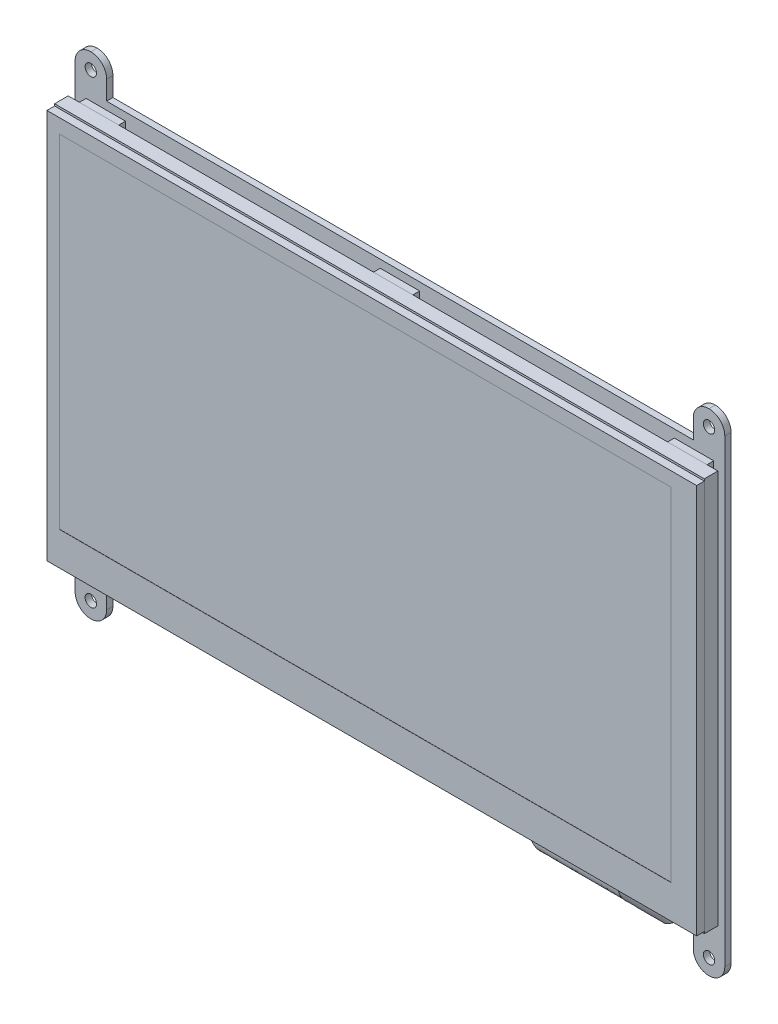
from build123d import *

# Parameters (mm, degrees)
PCBA_DEPTH         = 1.6
FILLET1_R          = 4
SKETCH2_R          = 1.45
SCREWHOLE_DEPTH    = 104.374149211
SKETCH5_W          = 10
SKETCH5_H          = 94.96
TAPE_DEPTH         = 1.75
SKETCH6_W          = 164.9
SKETCH6_H          = 100
BACKLIGHT_DEPTH    = 3.45
SKETCH7_W          = 164.9
SKETCH7_H          = 99
LCDNTOUCH_DEPTH    = 1.95
SWEEP1_START       = 62.28
SWEEP1_DEPTH       = 13.7
SWEEP2_START       = 38.48
SWEEP2_DEPTH       = 22.9
CUT_EXTRUDE3_DEPTH = 31.65
SKETCH16_W         = 155.2
SKETCH16_H         = 86.9
CUT_EXTRUDE4_DEPTH = 0.05


# Read off the part's stored shape, not the designer's step: Sweep1, Sweep2
with BuildPart() as part:
    # Sketch1 → PCBA (new body)
    with BuildSketch(Plane.XY):
        Polygon((74.45, 62.335), (82.45, 62.335), (82.45, -62.335), (74.45, -62.335), (74.45, -53.48), (-74.45, -53.48), (-74.45, -62.335), (-82.45, -62.335), (-82.45, 62.335), (-74.45, 62.335), (-74.45, 53.48), (74.45, 53.48), align=None)
    extrude(amount=PCBA_DEPTH)

    # Fillet1
    fillet1_edges = [part.edges().sort_by_distance(p)[0] for p in [
        (-82.45, 62.335, 0.8),
        (-74.45, 62.335, 0.8),
        (-82.45, -62.335, 0.8),
        (-74.45, -62.335, 0.8),
        (74.45, -62.335, 0.8),
        (82.45, -62.335, 0.8),
        (74.45, 62.335, 0.8),
        (82.45, 62.335, 0.8),
    ]]
    fillet(fillet1_edges, radius=FILLET1_R - 0.0001)  # a hair under: the kernel refuses the full size

    # Sketch2 → ScrewHole (cut, through all)
    with BuildSketch(Plane.XY.offset(1.6)):
        with Locations((-78.45, 58.335)):
            Circle(SKETCH2_R)
        with Locations((78.45, 58.335)):
            Circle(SKETCH2_R)
        with Locations((78.45, -58.335)):
            Circle(SKETCH2_R)
        with Locations((-78.45, -58.335)):
            Circle(SKETCH2_R)
    extrude(amount=-SCREWHOLE_DEPTH, mode=Mode.SUBTRACT)

    # Sketch5 → Tape (add)
    with BuildSketch(Plane.XY.offset(1.6)):
        with Locations((-74.65, 4)):
            Rectangle(SKETCH5_W, SKETCH5_H)
        with Locations((74.65, 4)):
            Rectangle(SKETCH5_W, SKETCH5_H)
        with Locations((0, 4)):
            Rectangle(SKETCH5_W, SKETCH5_H)
    extrude(amount=TAPE_DEPTH)



with BuildPart() as body_2:
    # Sketch6 → Backlight (new body)
    with BuildSketch(Plane.XY.offset(3.35)):
        with Locations((0, 1.52)):
            Rectangle(SKETCH6_W, SKETCH6_H)
    extrude(amount=BACKLIGHT_DEPTH)


with BuildPart() as body_3:
    # Sketch7 → LCDnTouch (new body)
    with BuildSketch(Plane.XY.offset(6.8)):
        with Locations((0, 1.52)):
            Rectangle(SKETCH7_W, SKETCH7_H)
    extrude(amount=LCDNTOUCH_DEPTH)


with BuildPart() as part_1:
    add(part.part)

    add(body_3.part)  # Sweep1 merges body 3
    # Sweep1 outline → Sweep1 (add)
    with BuildSketch(Plane.YZ.offset(SWEEP1_START)):
        with BuildLine():
            Line((-47.98, 8.35), (-47.98, 8.55))
            add(Edge.make_bspline(
                [(-47.98, 8.55), (-50.912403456, 7.72848927), (-52.382208971, 5.990192913), (-51.897184373, 3.081064394), (-50.448425543, 1.931894606), (-47.768774159, 1.6)],
                knots=[0, 0, 0, 0, 0.5, 0.5, 0.920075321, 0.920075321, 0.920075321, 0.920075321], degree=3))
            Line((-47.768774159, 1.6), (-46.078575055, 1.6))
            Line((-46.078575055, 1.6), (-46.051588588, 1.696289826))
            add(Edge.make_bspline(
                [(-47.98, 8.35), (-50.882100743, 7.521222553), (-52.197429111, 5.825675212), (-51.641753238, 2.953709182), (-49.776101832, 1.681049132), (-46.051588588, 1.696289826)],
                knots=[0, 0, 0, 0, 0.5, 0.5, 1, 1, 1, 1], degree=3))
        make_face()
    extrude(amount=SWEEP1_DEPTH)

    # Sweep2 outline → Sweep2 (add)
    with BuildSketch(Plane.YZ.offset(SWEEP2_START)):
        with BuildLine():
            Line((-47.98, 6.8), (-47.98, 7))
            add(Edge.make_bspline(
                [(-47.98, 7), (-49.110675347, 7.46570031), (-50.32572409, 7.329976113), (-52.089641205, 6.051762932), (-52.492002459, 4.760357324), (-51.217904856, 2.693421448), (-49.870436377, 1.875208104), (-47.443985346, 1.6)],
                knots=[0, 0, 0, 0, 0.302586662, 0.302586662, 0.651293331, 0.651293331, 0.947252102, 0.947252102, 0.947252102, 0.947252102], degree=3))
            Line((-47.443985346, 1.6), (-46.078575055, 1.6))
            Line((-46.078575055, 1.6), (-46.115156248, 1.69306888))
            add(Edge.make_bspline(
                [(-47.98, 6.8), (-49.048242707, 7.266417976), (-50.197952574, 7.156968521), (-51.871711427, 6.023186847), (-52.290428411, 4.86054287), (-51.078664372, 2.746662369), (-49.41521941, 1.78739192), (-46.115156248, 1.69306888)],
                knots=[0, 0, 0, 0, 0.302586662, 0.302586662, 0.651293331, 0.651293331, 1, 1, 1, 1], degree=3))
        make_face()
    extrude(amount=SWEEP2_DEPTH)

    # Sketch15 → Cut-Extrude3 (cut)
    with BuildSketch(Plane.XY.offset(1.6)):
        Polygon((38.48, -48.557400222), (40.98, -52.328343488), (70.98, -52.328343488), (75.98, -48.557400222), (75.98, -53.138786489), (38.248743189, -53.138786489), (38.248743189, -48.557400222), align=None)
    extrude(amount=CUT_EXTRUDE3_DEPTH, mode=Mode.SUBTRACT)

    # Sketch16 → Cut-Extrude4 (cut)
    with BuildSketch(Plane.XY.offset(8.75)):
        with Locations((-1.65, 3.97)):
            Rectangle(SKETCH16_W, SKETCH16_H)
    extrude(amount=-CUT_EXTRUDE4_DEPTH, mode=Mode.SUBTRACT)


solid = Compound([body_2.part, part_1.part])
